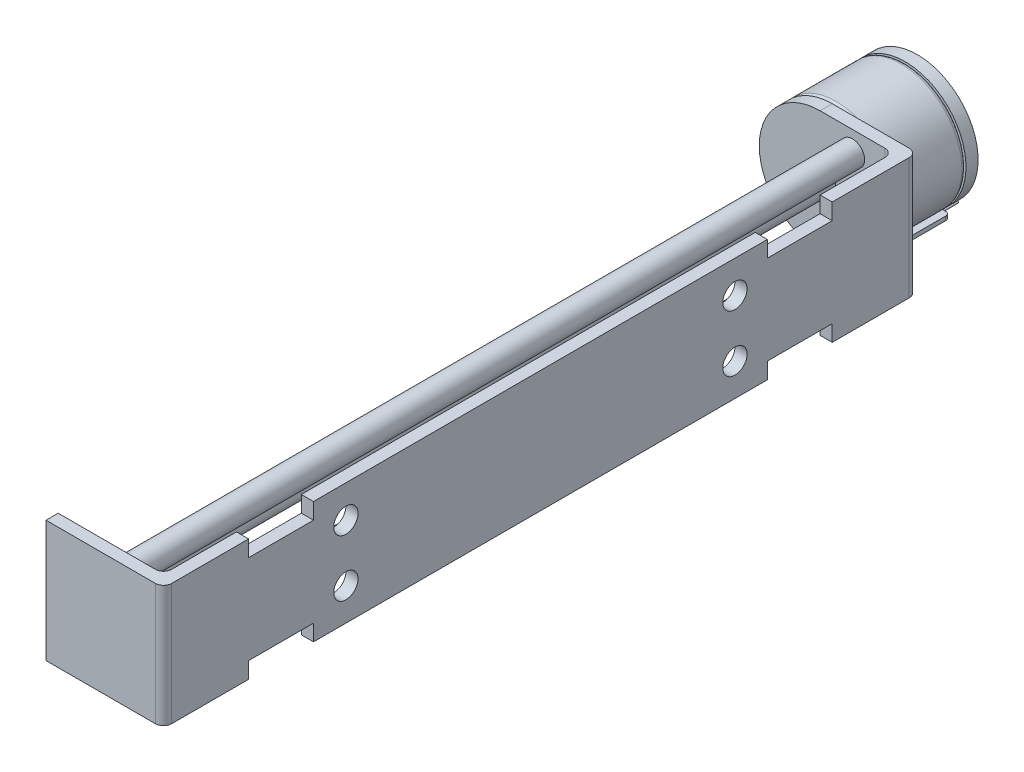
from build123d import *

# Parameters (mm, degrees)
SKETCH_1_R          = 1.5
EXTRUDE_1_DEPTH     = 90
SKETCH_2_R          = 1
EXTRUDE_2_DEPTH     = 3
CHAMFER_1_SIZE      = 1
SKETCH_3_R          = 7.5
EXTRUDE_3_DEPTH     = 9
FILLET_1_R          = 0.5
EXTRUDE_START       = 1.5
SKETCH_4_R          = 2
EXTRUDE_4_DEPTH     = 1.5
SKETCH_5_R          = 7.5
EXTRUDE_5_DEPTH     = 1.5
EXTRUDE_6_DEPTH     = 15
FILLET_2_R          = 1
SKETCH_8_W          = 8
SKETCH_8_H          = 2
SKETCH_8_R          = 1.5
CUT_EXTRUDE_1_DEPTH = 3
SKETCH_9_R          = 1.5
EXTRUDE_7_DEPTH     = 91.5
SKETCH_10_W         = 8
SKETCH_10_H         = 8
EXTRUDE_8_DEPTH     = 0.5
SKETCH_12_R         = 0.1
EXTRUDE_9_DEPTH     = 2
FILLET_3_R          = 0.5


with BuildPart() as part:
    # 草图1 → 凸台-拉伸1 (new body)
    with BuildSketch(Plane.XY):
        with Locations(Location((0, 0, 0), (0, 0, 180))):
            Circle(SKETCH_1_R)
    extrude(amount=EXTRUDE_1_DEPTH)

    # 草图2 → 凸台-拉伸2 (add)
    with BuildSketch(Plane.XY.offset(90)):
        Circle(SKETCH_2_R)
    extrude(amount=EXTRUDE_2_DEPTH)

    # 倒角1
    # the kernel refuses this chamfer: 1 mm, written as the material it adds along each edge
    with BuildSketch(Plane(origin=(0, 0, 90), x_dir=(1, 0, 0), z_dir=(0, -1, 0))) as chamfer_1_piece_1_section:
        Polygon((1 + CHAMFER_1_SIZE, 0), (1, CHAMFER_1_SIZE), (1, 0), align=None)
    chamfer_1_piece_1 = revolve(axis=Axis((0, 0, 90), (0, 0, 1)), mode=Mode.PRIVATE)
    chamfer_1_piece_1 = chamfer_1_piece_1 & Plane(origin=(0, 0, 90.753826293), x_dir=(-1, 0, 0), z_dir=(0, 0, -1)) * Cylinder(1.5, 8, mode=Mode.PRIVATE)
    add(chamfer_1_piece_1)

    # 草图3 → 凸台-拉伸3 (add)
    with BuildSketch(Plane(origin=(0, 0, 0), x_dir=(-1, 0, 0), z_dir=(0, 0, -1))):
        Circle(SKETCH_3_R)
    extrude(amount=EXTRUDE_3_DEPTH)

    # 圆角1
    fillet_1_edges = [part.edges().sort_by_distance(p)[0] for p in [
        (7.5, 0, 0),
        (7.5, 0, -9),
    ]]
    fillet(fillet_1_edges, radius=FILLET_1_R)

    # 草图4 → 凸台-拉伸4 (add)
    with BuildSketch(Plane.XY.offset(EXTRUDE_START)):
        with BuildLine():
            Line((0, 7.5), (10.5, 7.5))
            Line((10.5, 7.5), (10.5, -7.5))
            Line((10.5, -7.5), (0, -7.5))
            ThreePointArc((0, -7.5), (-7.5, 0), (0, 7.5))
        make_face()
        Circle(SKETCH_4_R, mode=Mode.SUBTRACT)
    extrude(amount=-EXTRUDE_4_DEPTH)

    # 草图5 → 凸台-拉伸5 (add)
    with BuildSketch(Plane(origin=(0, 0, -9), x_dir=(-1, 0, 0), z_dir=(0, 0, -1))):
        Circle(SKETCH_5_R)
    extrude(amount=EXTRUDE_5_DEPTH)

    # 草图7 → 凸台-拉伸6 (add)
    with BuildSketch(Plane.XZ.offset(7.5)):
        Polygon((10.5, 1.5), (10.5, 93), (-4, 93), (-4, 91.5), (9, 91.5), (9, 1.5), align=None)
    extrude(amount=-EXTRUDE_6_DEPTH)

    # 圆角2
    fillet_2_edges = [part.edges().sort_by_distance(p)[0] for p in [
        (10.5, 0, 0),
        (9, 0, 1.5),
        (9, 0, 91.5),
        (10.5, 0, 93),
    ]]
    fillet(fillet_2_edges, radius=FILLET_2_R)

    # 草图8 → 切除-拉伸1 (cut)
    with BuildSketch(Plane(origin=(10.5, 0, 0), x_dir=(0, 0, -1), z_dir=(1, 0, 0))):
        with Locations((-78.5, -6.5)):
            Rectangle(SKETCH_8_W, SKETCH_8_H)
        with Locations((-78.5, 6.5)):
            Rectangle(SKETCH_8_W, SKETCH_8_H)
        with Locations((-70.5, -3.5)):
            Circle(SKETCH_8_R)
        with Locations((-70.5, 3.5)):
            Circle(SKETCH_8_R)
        with Locations((-22.5, -3.5)):
            Circle(SKETCH_8_R)
        with Locations((-14.5, -6.5)):
            Rectangle(SKETCH_8_W, SKETCH_8_H)
        with Locations((-14.5, 6.5)):
            Rectangle(SKETCH_8_W, SKETCH_8_H)
        with Locations((-22.5, 3.5)):
            Circle(SKETCH_8_R)
    extrude(amount=-CUT_EXTRUDE_1_DEPTH, mode=Mode.SUBTRACT)

    # 草图9 → 凸台-拉伸7 (add)
    with BuildSketch(Plane.XY.offset(93)):
        with Locations((4, -5)):
            Circle(SKETCH_9_R)
        with Locations((4, 5)):
            Circle(SKETCH_9_R)
    extrude(amount=-EXTRUDE_7_DEPTH)


with BuildPart() as body_2:
    # 草图10 → 凸台-拉伸8 (new body)
    with BuildSketch(Plane(origin=(0, -7.5, 0), x_dir=(-1, 0, 0), z_dir=(0, -1, 0))):
        with Locations((0, 6.5)):
            Rectangle(SKETCH_10_W, SKETCH_10_H)
    extrude(amount=EXTRUDE_8_DEPTH)

    # 草图12 → 凸台-拉伸9 (add)
    with BuildSketch(Plane(origin=(0, 0, -10.5), x_dir=(-1, 0, 0), z_dir=(0, 0, -1))):
        with Locations(Location((1, -7.75, 0), (0, 0, 180))):
            Circle(SKETCH_12_R)
        with Locations(Location((3, -7.75, 0), (0, 0, 180))):
            Circle(SKETCH_12_R)
        with Locations(Location((-1, -7.75, 0), (0, 0, 180))):
            Circle(SKETCH_12_R)
        with Locations(Location((-3, -7.75, 0), (0, 0, 180))):
            Circle(SKETCH_12_R)
    extrude(amount=EXTRUDE_9_DEPTH)

    # 圆角3
    fillet_3_edges = [body_2.edges().sort_by_distance(p)[0] for p in [
        (4, -7.75, -10.5),
        (-4, -7.75, -10.5),
        (-4, -7.75, -2.5),
        (4, -7.75, -2.5),
    ]]
    fillet(fillet_3_edges, radius=FILLET_3_R)


solid = Compound([part.part, body_2.part])
